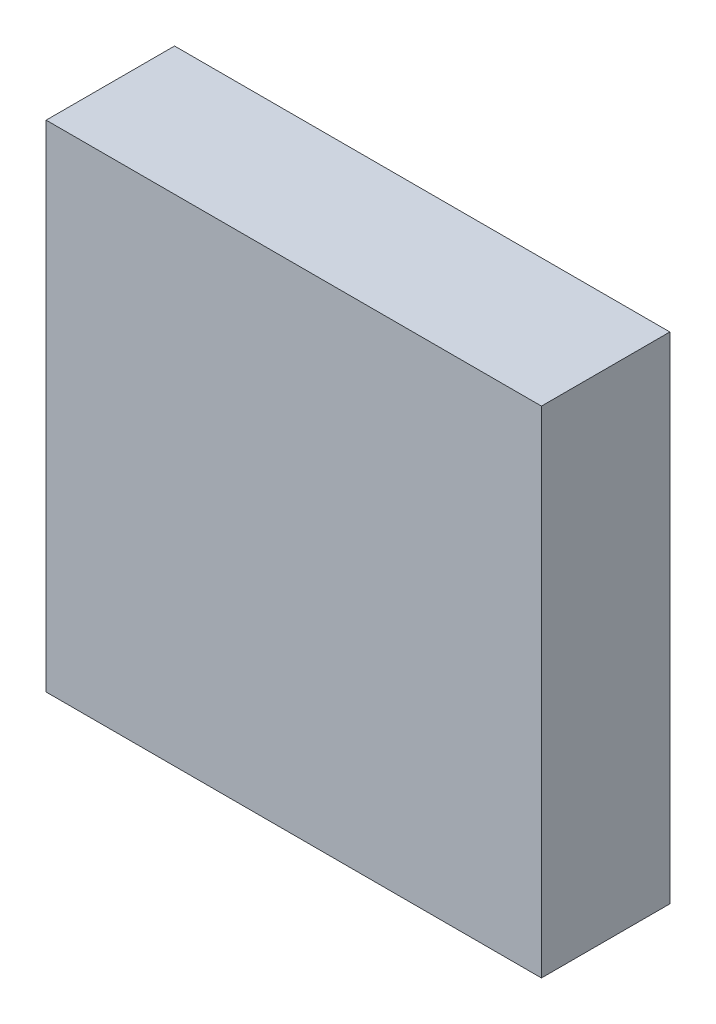
from build123d import *

# Parameters (mm, degrees)
SKIZZE1_W                       = 135
SKIZZE1_H                       = 135
SKIZZE1_W_2                     = 125
SKIZZE1_H_2                     = 125
AUFSATZ_LINEAR_AUSTRAGEN1_DEPTH = 30
SKIZZE2_W                       = 135
SKIZZE2_H                       = 135
AUFSATZ_LINEAR_AUSTRAGEN2_DEPTH = 5


with BuildPart() as part:
    # Skizze1 → Aufsatz-Linear austragen1 (new body)
    with BuildSketch(Plane.XY):
        Rectangle(SKIZZE1_W, SKIZZE1_H)
        Rectangle(SKIZZE1_W_2, SKIZZE1_H_2, mode=Mode.SUBTRACT)
    extrude(amount=AUFSATZ_LINEAR_AUSTRAGEN1_DEPTH)

    # Skizze2 → Aufsatz-Linear austragen2 (add)
    with BuildSketch(Plane.XY.offset(30)):
        Rectangle(SKIZZE2_W, SKIZZE2_H)
    extrude(amount=AUFSATZ_LINEAR_AUSTRAGEN2_DEPTH)


solid = part.part
